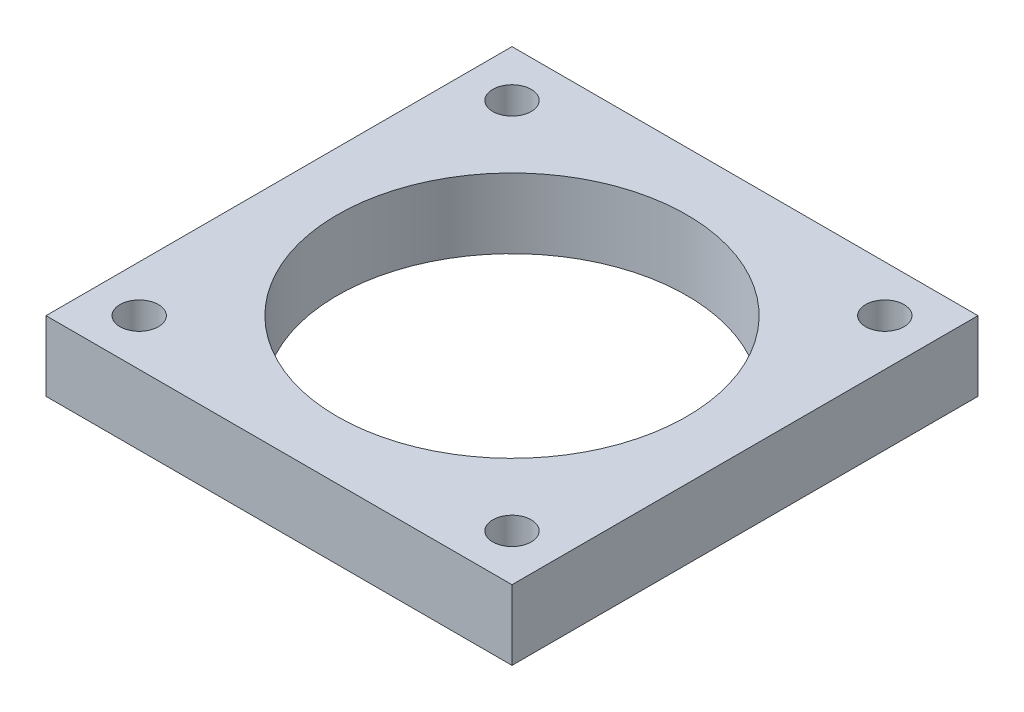
from build123d import *

# Parameters (mm, degrees)
SKETCH1_W           = 40
SKETCH1_H           = 40
SKETCH1_R           = 1.651
SKETCH1_R_2         = 15
BOSS_EXTRUDE1_DEPTH = 6


with BuildPart() as part:
    # Sketch1 → Boss-Extrude1 (new body)
    with BuildSketch(Plane(origin=(0, 0, 0), x_dir=(1, 0, 0), z_dir=(0, 1, 0))):
        with Locations((20, 20)):
            Rectangle(SKETCH1_W, SKETCH1_H)
        with Locations((4, 36)):
            Circle(SKETCH1_R, mode=Mode.SUBTRACT)
        with Locations((36, 36)):
            Circle(SKETCH1_R, mode=Mode.SUBTRACT)
        with Locations((4, 4)):
            Circle(SKETCH1_R, mode=Mode.SUBTRACT)
        with Locations((36, 4)):
            Circle(SKETCH1_R, mode=Mode.SUBTRACT)
        with Locations((20, 20)):
            Circle(SKETCH1_R_2, mode=Mode.SUBTRACT)
    extrude(amount=BOSS_EXTRUDE1_DEPTH)


solid = part.part
